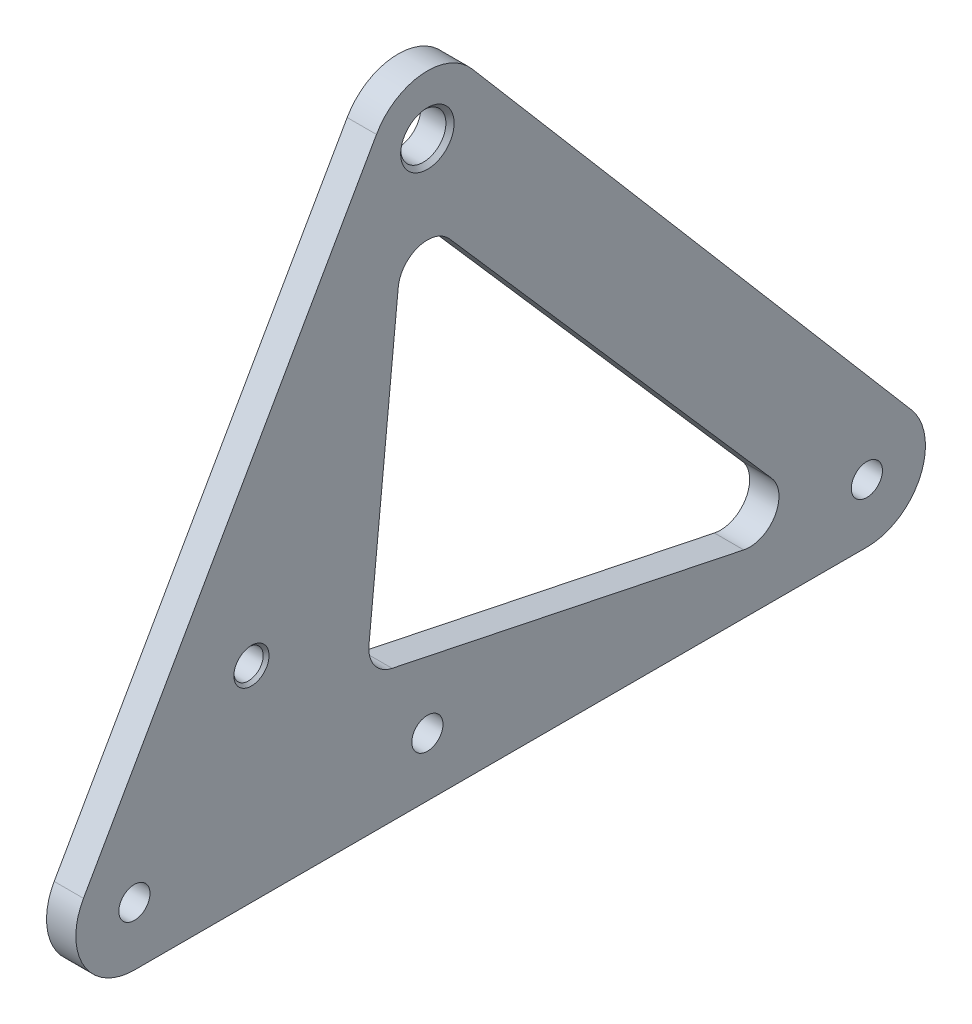
from build123d import *

# Parameters (mm, degrees)
BOSS_EXTRUDE1_DEPTH                  = 6.35
CUT_EXTRUDE1_REACH                   = 166.779
SKETCH2_R                            = 3.3782
F_3_8_CLEARANCE_HOLE1_D              = 9.8044
F_3_8_CLEARANCE_HOLE1_CSINK_D        = 11.58748
F_3_8_CLEARANCE_HOLE1_CSINK_ANGLE    = 90
F_1_4_0_2500_DOWEL_HOLE1_D           = 6.35
F_1_4_0_2500_DOWEL_HOLE1_CSINK_D     = 7.62
F_1_4_0_2500_DOWEL_HOLE1_CSINK_ANGLE = 90
CUT_EXTRUDE2_DEPTH                   = 165.779306616


with BuildPart() as part:
    # Sketch1 → Boss-Extrude1 (new body)
    with BuildSketch(Plane(origin=(0, 0, 0), x_dir=(0, 0, -1), z_dir=(1, 0, 0))):
        with BuildLine():
            Line((-74.539032088, -105.353687095), (-11.039032088, 6.279312905))
            ThreePointArc((-11.039032088, 6.279312905), (-1.199563995, 12.643221355), (9.661154553, 8.243305933))
            Line((9.661154553, 8.243305933), (104.911154553, -103.389694067))
            ThreePointArc((104.911154553, -103.389694067), (106.782128714, -116.95277512), (95.25, -124.333))
            Line((95.25, -124.333), (-63.5, -124.333))
            ThreePointArc((-63.5, -124.333), (-74.478098057, -118.018245731), (-74.539032088, -105.353687095))
        make_face()
    extrude(amount=BOSS_EXTRUDE1_DEPTH)

    # Sketch2 → Cut-Extrude1 (cut, up to next)
    with BuildSketch(Plane(origin=(6.35, 0, 0), x_dir=(0, 0, -1), z_dir=(1, 0, 0)), mode=Mode.PRIVATE) as cut_extrude1_sk1:
        with Locations((-63.5, -111.633)):
            Circle(SKETCH2_R)
    cut_extrude1_tool1 = extrude(cut_extrude1_sk1.sketch, amount=-CUT_EXTRUDE1_REACH, mode=Mode.PRIVATE) & part.part
    # Sketch2 → Cut-Extrude1 (cut, up to next)
    with BuildSketch(Plane(origin=(6.35, 0, 0), x_dir=(0, 0, -1), z_dir=(1, 0, 0)), mode=Mode.PRIVATE) as cut_extrude1_sk2:
        with Locations((0, -111.633)):
            Circle(SKETCH2_R)
    cut_extrude1_tool2 = extrude(cut_extrude1_sk2.sketch, amount=-CUT_EXTRUDE1_REACH, mode=Mode.PRIVATE) & part.part
    # Sketch2 → Cut-Extrude1 (cut, up to next)
    with BuildSketch(Plane(origin=(6.35, 0, 0), x_dir=(0, 0, -1), z_dir=(1, 0, 0)), mode=Mode.PRIVATE) as cut_extrude1_sk3:
        with Locations((95.25, -111.633)):
            Circle(SKETCH2_R)
    cut_extrude1_tool3 = extrude(cut_extrude1_sk3.sketch, amount=-CUT_EXTRUDE1_REACH, mode=Mode.PRIVATE) & part.part
    add(cut_extrude1_tool1.solids().sort_by_distance((6.35, -111.633, 63.5))[0], mode=Mode.SUBTRACT)
    add(cut_extrude1_tool2.solids().sort_by_distance((6.35, -111.633, 0))[0], mode=Mode.SUBTRACT)
    add(cut_extrude1_tool3.solids().sort_by_distance((6.35, -111.633, -95.25))[0], mode=Mode.SUBTRACT)

    # 3/8 Clearance Hole1 (through all)
    with Locations(Plane(origin=(6.35, 0, 0), x_dir=(0, 0, -1), z_dir=(1, 0, 0))):
        with Locations((0, 0)):
            CounterSinkHole(F_3_8_CLEARANCE_HOLE1_D / 2, F_3_8_CLEARANCE_HOLE1_CSINK_D / 2, counter_sink_angle=F_3_8_CLEARANCE_HOLE1_CSINK_ANGLE)

    # 1/4 (0.2500) Dowel Hole1 (through all)
    with Locations(Plane(origin=(6.35, 0, 0), x_dir=(0, 0, -1), z_dir=(1, 0, 0))):
        with Locations((-38.134262993, -79.883)):
            CounterSinkHole(F_1_4_0_2500_DOWEL_HOLE1_D / 2, F_1_4_0_2500_DOWEL_HOLE1_CSINK_D / 2, counter_sink_angle=F_1_4_0_2500_DOWEL_HOLE1_CSINK_ANGLE)

    # Sketch7 → Cut-Extrude2 (cut, through all)
    with BuildSketch(Plane(origin=(6.35, 0, 0), x_dir=(0, 0, -1), z_dir=(1, 0, 0))):
        with BuildLine():
            Line((-6.318980748, -24.773116989), (-12.668980748, -88.781116989))
            ThreePointArc((-12.668980748, -88.781116989), (-11.468755044, -93.16577152), (-7.645109514, -95.624525665))
            Line((-7.645109514, -95.624525665), (68.554890486, -111.499525665))
            ThreePointArc((68.554890486, -111.499525665), (75.332513767, -108.486832516), (74.630274091, -101.103110095))
            Line((74.630274091, -101.103110095), (4.780274091, -21.220110095))
            ThreePointArc((4.780274091, -21.220110095), (-1.935941384, -19.352303665), (-6.318980748, -24.773116989))
        make_face()
    extrude(amount=-CUT_EXTRUDE2_DEPTH, mode=Mode.SUBTRACT)


solid = part.part
